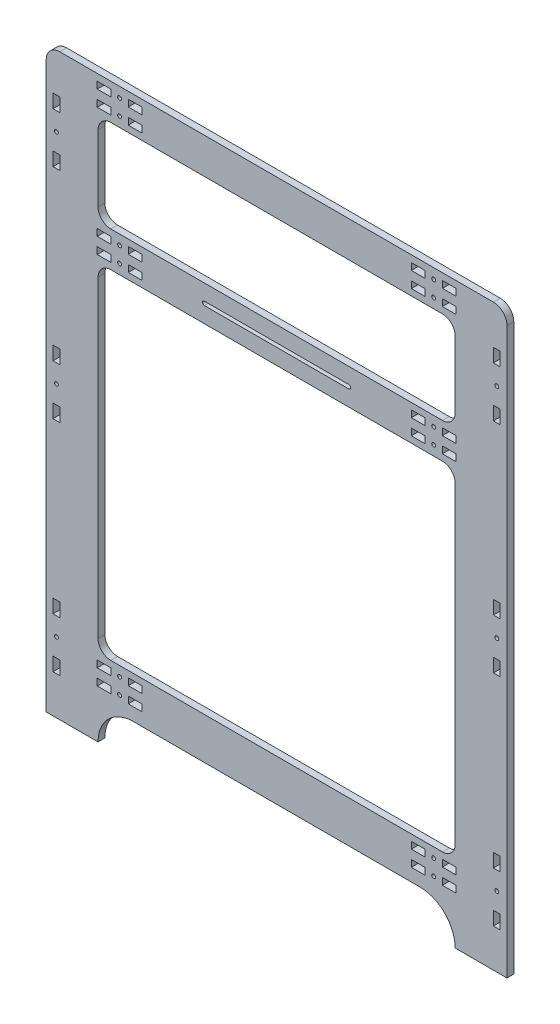
from build123d import *

# Parameters (mm, degrees)
SKETCH1_SIDE_SKETCH_2_W   = 5.333
SKETCH1_SIDE_SKETCH_2_H   = 10.666
SKETCH1_SIDE_SKETCH_2_W_2 = 10.666
SKETCH1_SIDE_SKETCH_2_H_2 = 5.333
SKETCH1_SIDE_SKETCH_2_R   = 1.5
BOSS_EXTRUDE1_DEPTH       = 5.333


with BuildPart() as part:
    # Sketch1-Side Sketch<2> → Boss-Extrude1 (new body)
    with BuildSketch(Plane.XY):
        with BuildLine():
            Line((170, 110.666), (-170, 110.666))
            ThreePointArc((-170, 110.666), (-177.542000928, 107.542000928), (-180.666, 100))
            Line((-180.666, 100), (-180.666, -343))
            Line((-180.666, -343), (-140, -343))
            ThreePointArc((-140, -343), (-131.896523315, -323.436476685), (-112.333, -315.333))
            Line((-112.333, -315.333), (112.333, -315.333))
            ThreePointArc((112.333, -315.333), (131.896523315, -323.436476685), (140, -343))
            Line((140, -343), (180.666, -343))
            Line((180.666, -343), (180.666, 100))
            ThreePointArc((180.666, 100), (177.542000928, 107.542000928), (170, 110.666))
        make_face()
        with Locations((172.6665, 74.667)):
            Rectangle(SKETCH1_SIDE_SKETCH_2_W, SKETCH1_SIDE_SKETCH_2_H, mode=Mode.SUBTRACT)
        with Locations((172.6665, 35.333)):
            Rectangle(SKETCH1_SIDE_SKETCH_2_W, SKETCH1_SIDE_SKETCH_2_H, mode=Mode.SUBTRACT)
        with Locations((172.6665, -96.5)):
            Rectangle(SKETCH1_SIDE_SKETCH_2_W, SKETCH1_SIDE_SKETCH_2_H, mode=Mode.SUBTRACT)
        with Locations((172.6665, -135.834)):
            Rectangle(SKETCH1_SIDE_SKETCH_2_W, SKETCH1_SIDE_SKETCH_2_H, mode=Mode.SUBTRACT)
        with Locations((172.6665, -268.333)):
            Rectangle(SKETCH1_SIDE_SKETCH_2_W, SKETCH1_SIDE_SKETCH_2_H, mode=Mode.SUBTRACT)
        with Locations((172.6665, -307.667)):
            Rectangle(SKETCH1_SIDE_SKETCH_2_W, SKETCH1_SIDE_SKETCH_2_H, mode=Mode.SUBTRACT)
        with Locations((-172.6665, -307.667)):
            Rectangle(SKETCH1_SIDE_SKETCH_2_W, SKETCH1_SIDE_SKETCH_2_H, mode=Mode.SUBTRACT)
        with Locations((-172.6665, -268.333)):
            Rectangle(SKETCH1_SIDE_SKETCH_2_W, SKETCH1_SIDE_SKETCH_2_H, mode=Mode.SUBTRACT)
        with Locations((-172.6665, -135.834)):
            Rectangle(SKETCH1_SIDE_SKETCH_2_W, SKETCH1_SIDE_SKETCH_2_H, mode=Mode.SUBTRACT)
        with Locations((-172.6665, -96.5)):
            Rectangle(SKETCH1_SIDE_SKETCH_2_W, SKETCH1_SIDE_SKETCH_2_H, mode=Mode.SUBTRACT)
        with Locations((-172.6665, 35.333)):
            Rectangle(SKETCH1_SIDE_SKETCH_2_W, SKETCH1_SIDE_SKETCH_2_H, mode=Mode.SUBTRACT)
        with Locations((-172.6665, 74.667)):
            Rectangle(SKETCH1_SIDE_SKETCH_2_W, SKETCH1_SIDE_SKETCH_2_H, mode=Mode.SUBTRACT)
        with Locations((-135.320282912, -302.6665)):
            Rectangle(SKETCH1_SIDE_SKETCH_2_W_2, SKETCH1_SIDE_SKETCH_2_H_2, mode=Mode.SUBTRACT)
        with Locations((-123.153282912, -302.6665)):
            Circle(SKETCH1_SIDE_SKETCH_2_R, mode=Mode.SUBTRACT)
        with Locations((-135.320282912, -290.3335)):
            Rectangle(SKETCH1_SIDE_SKETCH_2_W_2, SKETCH1_SIDE_SKETCH_2_H_2, mode=Mode.SUBTRACT)
        with Locations((-123.153282912, -290.3335)):
            Circle(SKETCH1_SIDE_SKETCH_2_R, mode=Mode.SUBTRACT)
        with Locations((-110.986282912, -302.6665)):
            Rectangle(SKETCH1_SIDE_SKETCH_2_W_2, SKETCH1_SIDE_SKETCH_2_H_2, mode=Mode.SUBTRACT)
        with Locations((-110.986282912, -290.3335)):
            Rectangle(SKETCH1_SIDE_SKETCH_2_W_2, SKETCH1_SIDE_SKETCH_2_H_2, mode=Mode.SUBTRACT)
        with BuildLine():
            Line((-130, -17.333), (130, -17.333))
            ThreePointArc((130, -17.333), (137.071067812, -20.261932188), (140, -27.333))
            Line((140, -27.333), (140, -272.667))
            ThreePointArc((140, -272.667), (137.071067812, -279.738067812), (130, -282.667))
            Line((130, -282.667), (-130, -282.667))
            ThreePointArc((-130, -282.667), (-137.071067812, -279.738067812), (-140, -272.667))
            Line((-140, -272.667), (-140, -27.333))
            ThreePointArc((-140, -27.333), (-137.071067812, -20.261932188), (-130, -17.333))
        make_face(mode=Mode.SUBTRACT)
        with Locations((110.986282912, -302.6665)):
            Rectangle(SKETCH1_SIDE_SKETCH_2_W_2, SKETCH1_SIDE_SKETCH_2_H_2, mode=Mode.SUBTRACT)
        with Locations((110.986282912, -290.3335)):
            Rectangle(SKETCH1_SIDE_SKETCH_2_W_2, SKETCH1_SIDE_SKETCH_2_H_2, mode=Mode.SUBTRACT)
        with Locations((123.153282912, -302.6665)):
            Circle(SKETCH1_SIDE_SKETCH_2_R, mode=Mode.SUBTRACT)
        with Locations((135.320282912, -302.6665)):
            Rectangle(SKETCH1_SIDE_SKETCH_2_W_2, SKETCH1_SIDE_SKETCH_2_H_2, mode=Mode.SUBTRACT)
        with Locations((123.153282912, -290.3335)):
            Circle(SKETCH1_SIDE_SKETCH_2_R, mode=Mode.SUBTRACT)
        with Locations((135.320282912, -290.3335)):
            Rectangle(SKETCH1_SIDE_SKETCH_2_W_2, SKETCH1_SIDE_SKETCH_2_H_2, mode=Mode.SUBTRACT)
        with Locations((-135.320282912, -9.6665)):
            Rectangle(SKETCH1_SIDE_SKETCH_2_W_2, SKETCH1_SIDE_SKETCH_2_H_2, mode=Mode.SUBTRACT)
        with Locations((-123.153282912, -9.6665)):
            Circle(SKETCH1_SIDE_SKETCH_2_R, mode=Mode.SUBTRACT)
        with Locations((-110.986282912, -9.6665)):
            Rectangle(SKETCH1_SIDE_SKETCH_2_W_2, SKETCH1_SIDE_SKETCH_2_H_2, mode=Mode.SUBTRACT)
        with BuildLine():
            ThreePointArc((-56.666666667, -5), (-58.166666667, -3.5), (-56.666666667, -2))
            Line((-56.666666667, -2), (56.666666667, -2))
            ThreePointArc((56.666666667, -2), (58.166666667, -3.5), (56.666666667, -5))
            Line((56.666666667, -5), (-56.666666667, -5))
        make_face(mode=Mode.SUBTRACT)
        with Locations((-135.320282912, 2.6665)):
            Rectangle(SKETCH1_SIDE_SKETCH_2_W_2, SKETCH1_SIDE_SKETCH_2_H_2, mode=Mode.SUBTRACT)
        with Locations((-123.153282912, 2.6665)):
            Circle(SKETCH1_SIDE_SKETCH_2_R, mode=Mode.SUBTRACT)
        with Locations((-110.986282912, 2.6665)):
            Rectangle(SKETCH1_SIDE_SKETCH_2_W_2, SKETCH1_SIDE_SKETCH_2_H_2, mode=Mode.SUBTRACT)
        with Locations((-135.320282912, 90.3335)):
            Rectangle(SKETCH1_SIDE_SKETCH_2_W_2, SKETCH1_SIDE_SKETCH_2_H_2, mode=Mode.SUBTRACT)
        with Locations((-123.153282912, 90.3335)):
            Circle(SKETCH1_SIDE_SKETCH_2_R, mode=Mode.SUBTRACT)
        with Locations((-135.320282912, 102.6665)):
            Rectangle(SKETCH1_SIDE_SKETCH_2_W_2, SKETCH1_SIDE_SKETCH_2_H_2, mode=Mode.SUBTRACT)
        with Locations((-123.153282912, 102.6665)):
            Circle(SKETCH1_SIDE_SKETCH_2_R, mode=Mode.SUBTRACT)
        with Locations((-110.986282912, 90.3335)):
            Rectangle(SKETCH1_SIDE_SKETCH_2_W_2, SKETCH1_SIDE_SKETCH_2_H_2, mode=Mode.SUBTRACT)
        with Locations((-110.986282912, 102.6665)):
            Rectangle(SKETCH1_SIDE_SKETCH_2_W_2, SKETCH1_SIDE_SKETCH_2_H_2, mode=Mode.SUBTRACT)
        with BuildLine():
            Line((-130, 82.667), (130, 82.667))
            ThreePointArc((130, 82.667), (137.071067812, 79.738067812), (140, 72.667))
            Line((140, 72.667), (140, 20.333))
            ThreePointArc((140, 20.333), (137.071067812, 13.261932188), (130, 10.333))
            Line((130, 10.333), (-130, 10.333))
            ThreePointArc((-130, 10.333), (-137.071067812, 13.261932188), (-140, 20.333))
            Line((-140, 20.333), (-140, 72.667))
            ThreePointArc((-140, 72.667), (-137.071067812, 79.738067812), (-130, 82.667))
        make_face(mode=Mode.SUBTRACT)
        with Locations((110.986282912, -9.6665)):
            Rectangle(SKETCH1_SIDE_SKETCH_2_W_2, SKETCH1_SIDE_SKETCH_2_H_2, mode=Mode.SUBTRACT)
        with Locations((123.153282912, -9.6665)):
            Circle(SKETCH1_SIDE_SKETCH_2_R, mode=Mode.SUBTRACT)
        with Locations((135.320282912, -9.6665)):
            Rectangle(SKETCH1_SIDE_SKETCH_2_W_2, SKETCH1_SIDE_SKETCH_2_H_2, mode=Mode.SUBTRACT)
        with Locations((110.986282912, 2.6665)):
            Rectangle(SKETCH1_SIDE_SKETCH_2_W_2, SKETCH1_SIDE_SKETCH_2_H_2, mode=Mode.SUBTRACT)
        with Locations((123.153282912, 2.6665)):
            Circle(SKETCH1_SIDE_SKETCH_2_R, mode=Mode.SUBTRACT)
        with Locations((135.320282912, 2.6665)):
            Rectangle(SKETCH1_SIDE_SKETCH_2_W_2, SKETCH1_SIDE_SKETCH_2_H_2, mode=Mode.SUBTRACT)
        with Locations((110.986282912, 90.3335)):
            Rectangle(SKETCH1_SIDE_SKETCH_2_W_2, SKETCH1_SIDE_SKETCH_2_H_2, mode=Mode.SUBTRACT)
        with Locations((110.986282912, 102.6665)):
            Rectangle(SKETCH1_SIDE_SKETCH_2_W_2, SKETCH1_SIDE_SKETCH_2_H_2, mode=Mode.SUBTRACT)
        with Locations((123.153282912, 90.3335)):
            Circle(SKETCH1_SIDE_SKETCH_2_R, mode=Mode.SUBTRACT)
        with Locations((135.320282912, 90.3335)):
            Rectangle(SKETCH1_SIDE_SKETCH_2_W_2, SKETCH1_SIDE_SKETCH_2_H_2, mode=Mode.SUBTRACT)
        with Locations((123.153282912, 102.6665)):
            Circle(SKETCH1_SIDE_SKETCH_2_R, mode=Mode.SUBTRACT)
        with Locations((135.320282912, 102.6665)):
            Rectangle(SKETCH1_SIDE_SKETCH_2_W_2, SKETCH1_SIDE_SKETCH_2_H_2, mode=Mode.SUBTRACT)
        with Locations((172.6665, -116.167)):
            Circle(SKETCH1_SIDE_SKETCH_2_R, mode=Mode.SUBTRACT)
        with Locations((172.6665, 55)):
            Circle(SKETCH1_SIDE_SKETCH_2_R, mode=Mode.SUBTRACT)
        with Locations((172.6665, -288)):
            Circle(SKETCH1_SIDE_SKETCH_2_R, mode=Mode.SUBTRACT)
        with Locations((-172.6665, -288)):
            Circle(SKETCH1_SIDE_SKETCH_2_R, mode=Mode.SUBTRACT)
        with Locations((-172.6665, -116.167)):
            Circle(SKETCH1_SIDE_SKETCH_2_R, mode=Mode.SUBTRACT)
        with Locations((-172.6665, 55)):
            Circle(SKETCH1_SIDE_SKETCH_2_R, mode=Mode.SUBTRACT)
    extrude(amount=BOSS_EXTRUDE1_DEPTH)


solid = part.part
